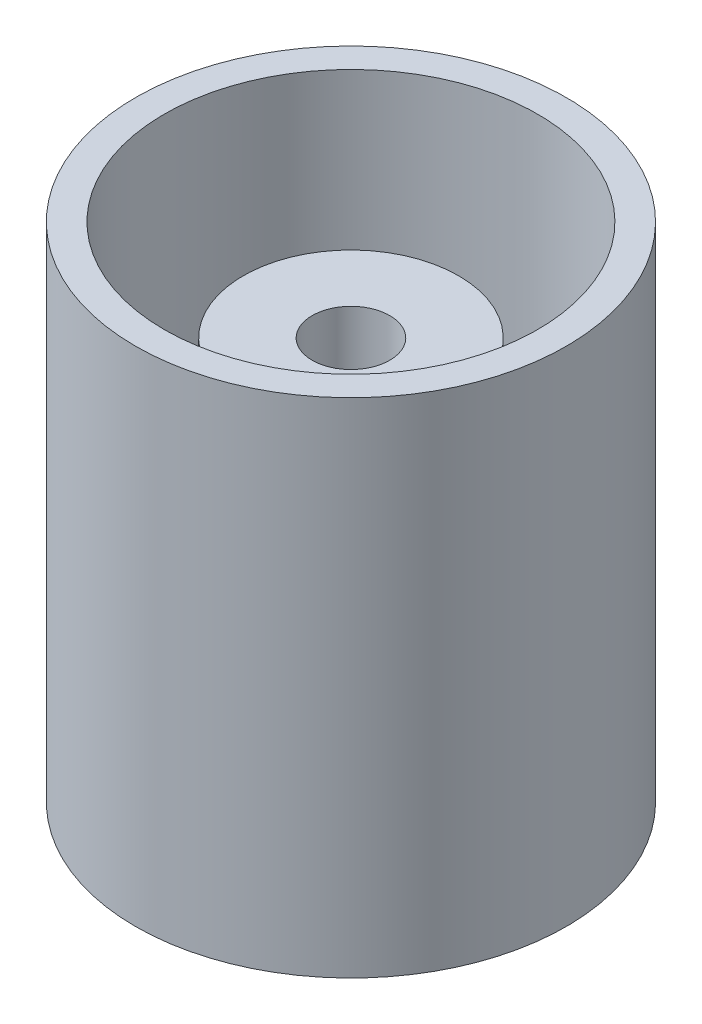
from build123d import *

# Parameters (mm, degrees)
SKETCH1_R           = 15
BOSS_EXTRUDE1_DEPTH = 15
SKETCH2_R           = 7.5
BOSS_EXTRUDE2_DEPTH = 13
SKETCH3_R           = 15
SKETCH3_R_2         = 13
BOSS_EXTRUDE4_DEPTH = 20
SKETCH4_R           = 2.7
CUT_EXTRUDE1_DEPTH  = 30


with BuildPart() as part:
    # Sketch1 → Boss-Extrude1 (new body)
    with BuildSketch(Plane(origin=(0, 0, 0), x_dir=(1, 0, 0), z_dir=(0, 1, 0))):
        Circle(SKETCH1_R)
    extrude(amount=BOSS_EXTRUDE1_DEPTH)

    # Sketch2 → Boss-Extrude2 (add)
    with BuildSketch(Plane(origin=(0, 15, 0), x_dir=(1, 0, 0), z_dir=(0, 1, 0))):
        Circle(SKETCH2_R)
    extrude(amount=BOSS_EXTRUDE2_DEPTH)

    # Sketch3 → Boss-Extrude4 (add)
    with BuildSketch(Plane(origin=(0, 15, 0), x_dir=(1, 0, 0), z_dir=(0, 1, 0))):
        Circle(SKETCH3_R)
        Circle(SKETCH3_R_2, mode=Mode.SUBTRACT)
    extrude(amount=BOSS_EXTRUDE4_DEPTH)

    # Sketch4 → Cut-Extrude1 (cut)
    with BuildSketch(Plane(origin=(0, 28, 0), x_dir=(1, 0, 0), z_dir=(0, 1, 0))):
        Circle(SKETCH4_R)
    extrude(amount=-CUT_EXTRUDE1_DEPTH, mode=Mode.SUBTRACT)


solid = part.part
